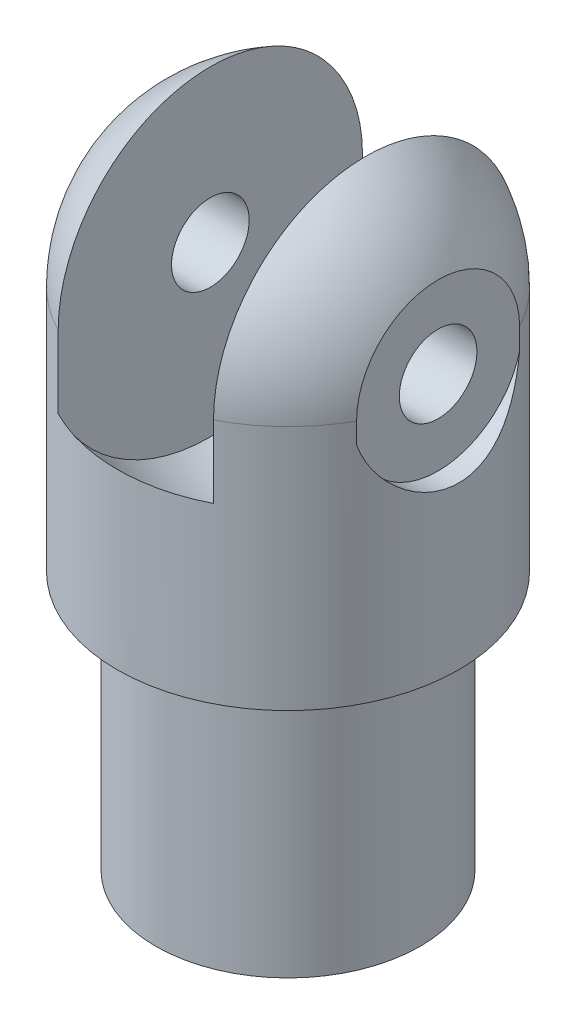
from build123d import *

# Parameters (mm, degrees)
SKETCH1_R               = 12.9794
BOSS_EXTRUDE1_DEPTH     = 25.4
CUT_EXTRUDE1_DEPTH      = 71.405666164
CUT_EXTRUDE1_DEPTH_BACK = 71.405666164
SKETCH3_R               = 3.81
SKETCH6_R               = 8.255
CUT_EXTRUDE2_DEPTH      = 2.032


with BuildPart() as part:
    # Sketch1 → Boss-Extrude1 (new body)
    with BuildSketch(Plane(origin=(0, 0, 0), x_dir=(1, 0, 0), z_dir=(0, 1, 0))):
        Circle(SKETCH1_R)
    extrude(amount=BOSS_EXTRUDE1_DEPTH)

    # Sketch2 → Revolve1 (revolve)
    with BuildSketch(Plane(origin=(0, 0, 0), x_dir=(0, 0, -1), z_dir=(1, 0, 0))):
        with BuildLine():
            Line((-16.764, 25.4), (-16.764, 49.53))
            ThreePointArc((-16.764, 49.53), (-11.85393808, 61.38393808), (0, 66.294))
            Line((0, 66.294), (0, 25.4))
            Line((0, 25.4), (-16.764, 25.4))
        make_face()
    revolve(axis=Axis((0, 25.4, 0), (0, 1, 0)))

    # Sketch3 → Cut-Extrude1 (cut, two sides: drawn at the far end of the back side and taken through both)
    with BuildSketch(Plane(origin=(0, 0, 0), x_dir=(0, 0, -1), z_dir=(1, 0, 0)).offset(-CUT_EXTRUDE1_DEPTH_BACK)):
        with Locations((0, 49.53)):
            Circle(SKETCH3_R)
    extrude(amount=CUT_EXTRUDE1_DEPTH + CUT_EXTRUDE1_DEPTH_BACK, mode=Mode.SUBTRACT)

    # Sketch4 → Cut-Revolve1 (revolve, cut)
    with BuildSketch(Plane.XY):
        with BuildLine():
            Line((-7.62, 32.995439638), (-7.62, 49.53))
            Line((-7.62, 49.53), (7.62, 49.53))
            Line((7.62, 49.53), (7.62, 32.995439638))
            ThreePointArc((7.62, 32.995439638), (0, 31.32406453), (-7.62, 32.995439638))
        make_face()
    revolve(axis=Axis((-7.62, 49.53, 0), (1, 0, 0)), mode=Mode.SUBTRACT)

    # Sketch6 → Cut-Extrude2 (cut)
    with BuildSketch(Plane(origin=(16.764, 0, 0), x_dir=(0, 0, -1), z_dir=(1, 0, 0))):
        with Locations((0, 49.53)):
            Circle(SKETCH6_R)
    cut_extrude2 = extrude(amount=-CUT_EXTRUDE2_DEPTH, mode=Mode.SUBTRACT)

    # Mirror1: Cut-Extrude2 across plane
    add(cut_extrude2.mirror(Plane(origin=(0, 0, 0), x_dir=(0, 0, 1), z_dir=(1, 0, 0))), mode=Mode.SUBTRACT)


solid = part.part
